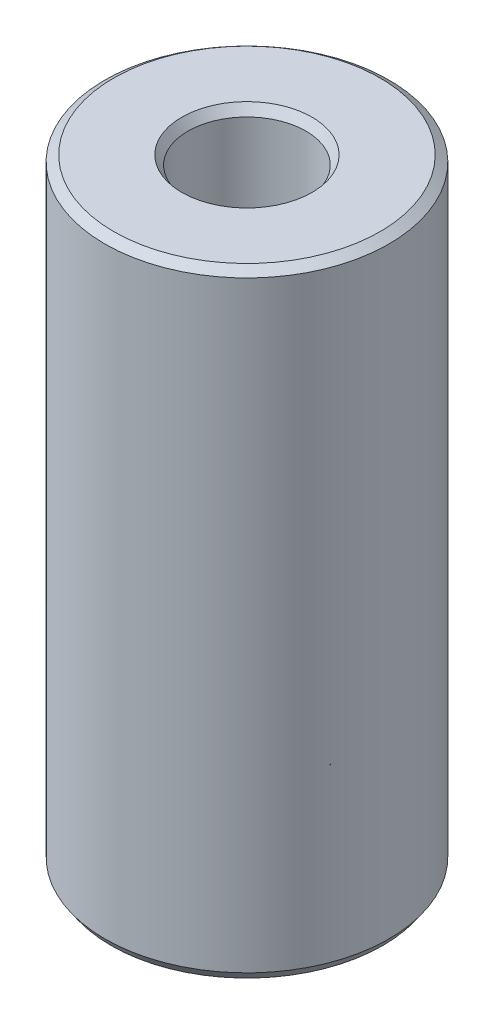
from build123d import *
from OCP.BRepFilletAPI import BRepFilletAPI_MakeChamfer

# Parameters (mm, degrees)
SKETCH1_R           = 32.5
BOSS_EXTRUDE1_DEPTH = 141.156435356
SKETCH2_R           = 13.492353523
CUT_EXTRUDE1_DEPTH  = 149.450797379
CHAMFER1_SIZE       = 1.422317696
CHAMFER1_SIZE2      = 2.040494184


with BuildPart() as part:
    # Sketch1 → Boss-Extrude1 (new body)
    with BuildSketch(Plane(origin=(0, 0, 0), x_dir=(1, 0, 0), z_dir=(0, 1, 0))):
        Circle(SKETCH1_R)
    extrude(amount=BOSS_EXTRUDE1_DEPTH)

    # Sketch2 → Cut-Extrude1 (cut, through all)
    with BuildSketch(Plane(origin=(0, 0, 0), x_dir=(1, 0, 0), z_dir=(0, 1, 0))):
        Circle(SKETCH2_R)
    extrude(amount=CUT_EXTRUDE1_DEPTH, mode=Mode.SUBTRACT)

    # Chamfer1: one chamfer whose edges measure the first distance from different faces: ONE call of the kernel's chamfer builder (chamfer() names one face for all edges)
    chamfer1_edges_1 = [part.edges().sort_by_distance(p)[0] for p in [
        (-13.492353523, 141.156435356, 0),
    ]]
    chamfer1_side_1 = [part.faces().sort_by_distance(p)[0] for p in [
        (-31.580761184, 141.156435356, 0),
    ]]
    chamfer1_edges_2 = [part.edges().sort_by_distance(p)[0] for p in [
        (-13.492353523, 0, 0),
    ]]
    chamfer1_side_2 = [part.faces().sort_by_distance(p)[0] for p in [
        (-13.492353523, 70.578217678, 0),
    ]]
    chamfer1_edges_3 = [part.edges().sort_by_distance(p)[0] for p in [
        (-32.5, 0, 0),
    ]]
    chamfer1_side_3 = [part.faces().sort_by_distance(p)[0] for p in [
        (-31.580761184, 0, 0),
    ]]
    chamfer1_edges_4 = [part.edges().sort_by_distance(p)[0] for p in [
        (-32.5, 141.156435356, 0),
    ]]
    chamfer1_side_4 = [part.faces().sort_by_distance(p)[0] for p in [
        (-32.5, 70.578217678, 0),
    ]]
    chamfer1 = BRepFilletAPI_MakeChamfer(part.part.solid().wrapped)
    for e in chamfer1_edges_1:
        chamfer1.Add(CHAMFER1_SIZE, CHAMFER1_SIZE2, e.wrapped, chamfer1_side_1[0].wrapped)  # the first distance lies on this face
    for e in chamfer1_edges_2:
        chamfer1.Add(CHAMFER1_SIZE, CHAMFER1_SIZE2, e.wrapped, chamfer1_side_2[0].wrapped)  # the first distance lies on this face
    for e in chamfer1_edges_3:
        chamfer1.Add(CHAMFER1_SIZE, CHAMFER1_SIZE2, e.wrapped, chamfer1_side_3[0].wrapped)  # the first distance lies on this face
    for e in chamfer1_edges_4:
        chamfer1.Add(CHAMFER1_SIZE, CHAMFER1_SIZE2, e.wrapped, chamfer1_side_4[0].wrapped)  # the first distance lies on this face
    add(Compound.cast(chamfer1.Shape()), mode=Mode.REPLACE)


solid = part.part
